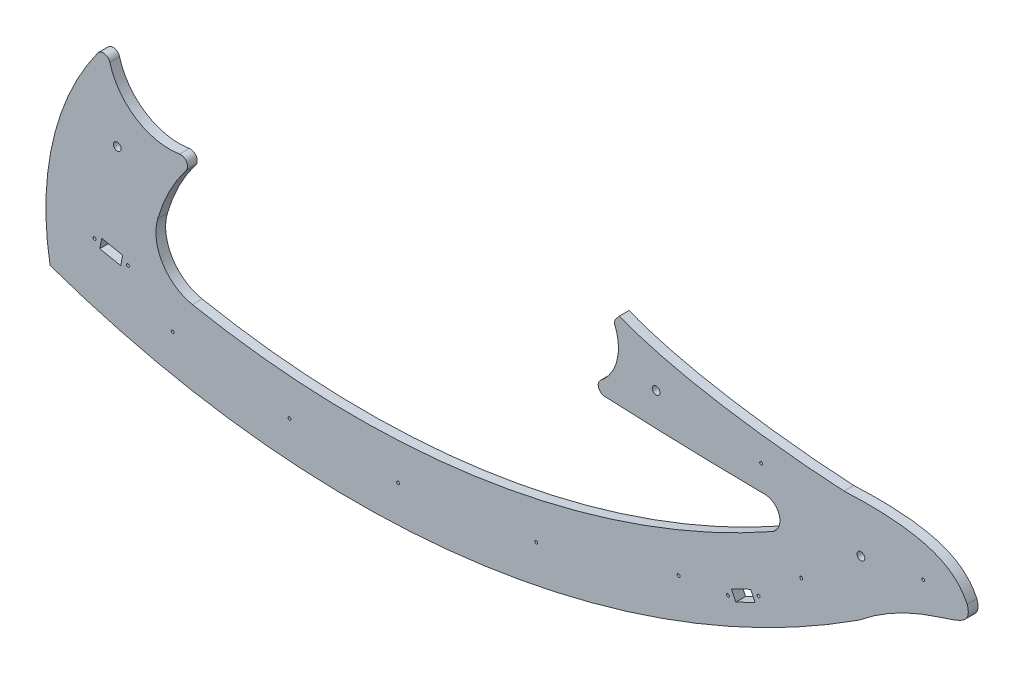
from build123d import *

# Parameters (mm, degrees)
EXTRUDE_3286_DEPTH      = 10
CUT_EXTRUDE_11138_REACH = 1083.261
SKETCH11_R              = 4
SKETCH11_R_2            = 1.5


with BuildPart() as part:
    # Sketch 220 → Extrude 3286 (new body)
    with BuildSketch(Plane.XY):
        with BuildLine():
            Line((398.785011417, -200.651493516), (-79.294784876, -202.700029576))
            add(Edge.make_bspline(
                [(-79.294784876, -202.700029576), (-78.517207033, -227.700030074), (-66.77413567, -249.709423293), (-44.177194857, -268.758733778)],
                knots=[0.130434783, 0.130434783, 0.130434783, 0.130434783, 0.173913043, 0.173913043, 0.173913043, 0.173913043], degree=3))
            add(Edge.make_bspline(
                [(-44.177194857, -268.758733778), (-12.705791537, -245.829015584), (38.959692419, -231.734357298), (82.666649693, -241.803965427)],
                knots=[0.173913043, 0.173913043, 0.173913043, 0.173913043, 0.217391304, 0.217391304, 0.217391304, 0.217391304], degree=3))
            add(Edge.make_bspline(
                [(82.666649693, -241.803965427), (105.678664452, -251.652519997), (111.246401119, -268.691898993), (94.211511027, -290.72343747)],
                knots=[0.217391304, 0.217391304, 0.217391304, 0.217391304, 0.260869565, 0.260869565, 0.260869565, 0.260869565], degree=3))
            add(Edge.make_bspline(
                [(94.211511027, -290.72343747), (87.158146802, -299.84568745), (74.983143168, -308.421687748), (61.059861243, -320.502125148)],
                knots=[0.260869565, 0.260869565, 0.260869565, 0.260869565, 0.304347826, 0.304347826, 0.304347826, 0.304347826], degree=3))
            add(Edge.make_bspline(
                [(61.059861243, -320.502125148), (47.380576162, -331.841195194), (34.883169502, -345.267804883), (22.870464668, -359.106695422)],
                knots=[0.304347826, 0.304347826, 0.304347826, 0.304347826, 0.347826087, 0.347826087, 0.347826087, 0.347826087], degree=3))
            add(Edge.make_bspline(
                [(22.870464668, -359.106695422), (-5.584395486, -391.889656597), (-25.592236503, -386.636342684), (-46.417157713, -376.787588607)],
                knots=[0.347826087, 0.347826087, 0.347826087, 0.347826087, 0.391304348, 0.391304348, 0.391304348, 0.391304348], degree=3))
            add(Edge.make_bspline(
                [(-46.417157713, -376.787588607), (-71.990241561, -366.221906762), (-92.784039707, -356.68149048), (-112.974728727, -345.609360564)],
                knots=[0.391304348, 0.391304348, 0.391304348, 0.391304348, 0.434782609, 0.434782609, 0.434782609, 0.434782609], degree=3))
            ThreePointArc((-112.974728727, -345.609360564), (-147.291018167, -331.50605668), (-183.878601839, -325.353039337))
            ThreePointArc((-183.878601839, -325.353039337), (-234.41691777, -376.347060605), (-177.788935429, -420.480757462))
            ThreePointArc((-177.788935429, -420.480757462), (-128.557787466, -442.172804122), (-130.703269603, -495.928247794))
            ThreePointArc((-130.703269603, -495.928247794), (-178.505297895, -598.929354982), (-181.694355183, -712.437468808))
            ThreePointArc((-181.694355183, -712.437468808), (245.849512772, -759.184021524), (650.190442214, -612.598169561))
            add(Edge.make_bspline(
                [(650.190442214, -612.598169561), (721.726306985, -555.13661338), (771.374178439, -572.802842814), (761.971022851, -542.438303349)],
                knots=[0.695652174, 0.695652174, 0.695652174, 0.695652174, 0.739130435, 0.739130435, 0.739130435, 0.739130435], degree=3))
            add(Edge.make_bspline(
                [(761.971022851, -542.438303349), (749.988144288, -518.251093648), (723.103402832, -500.836242812), (635.239899657, -505.006434182)],
                knots=[0.739130435, 0.739130435, 0.739130435, 0.739130435, 0.782608696, 0.782608696, 0.782608696, 0.782608696], degree=3))
            add(Edge.make_bspline(
                [(635.239899657, -505.006434182), (572.991975282, -501.932832065), (433.550272387, -486.778792548), (380.910397107, -452.903731023)],
                knots=[0.782608696, 0.782608696, 0.782608696, 0.782608696, 0.826086957, 0.826086957, 0.826086957, 0.826086957], degree=3))
            add(Edge.make_bspline(
                [(380.910397107, -452.903731023), (364.765905966, -442.514313456), (356.786231562, -430.363849161), (361.702578451, -416.260911342)],
                knots=[0.826086957, 0.826086957, 0.826086957, 0.826086957, 0.869565217, 0.869565217, 0.869565217, 0.869565217], degree=3))
            add(Edge.make_bspline(
                [(361.702578451, -416.260911342), (369.757666434, -319.561849491), (455.747401527, -287.137003064), (480.242749516, -200.302456329)],
                knots=[0.869565217, 0.869565217, 0.869565217, 0.869565217, 0.913043478, 0.913043478, 0.913043478, 0.913043478], degree=3))
            add(Edge.make_bspline(
                [(480.242749516, -200.302456329), (553.544349425, -5.601453319), (495.010045056, 115.276837959), (568.085803242, 187.174308847)],
                knots=[0.913043478, 0.913043478, 0.913043478, 0.913043478, 0.956521739, 0.956521739, 0.956521739, 0.956521739], degree=3))
            ThreePointArc((568.085803242, 187.174308847), (593.606841589, 203.592061702), (604.925253944, 231.748047725))
            ThreePointArc((604.925253944, 231.748047725), (600.64196866, 247.878688747), (587.30163028, 257.907621119))
            ThreePointArc((587.30163028, 257.907621119), (571.737485415, 260.097118561), (556.344046154, 256.922448156))
            add(Edge.make_bspline(
                [(556.344046154, 256.922448156), (413.493143177, 200.699964154), (492.80385804, -30.446360595), (410.726691822, -175.599321984)],
                knots=[0.000400641, 0.000400641, 0.000400641, 0.000400641, 0.043478261, 0.043478261, 0.043478261, 0.043478261], degree=3))
            add(Edge.make_bspline(
                [(410.726691822, -175.599321984), (407.231033021, -184.649150987), (403.219250068, -192.928185379), (398.785011417, -200.651493516)],
                knots=[0.043478261, 0.043478261, 0.043478261, 0.043478261, 0.086956522, 0.086956522, 0.086956522, 0.086956522], degree=3))
        make_face()
        with BuildLine():
            ThreePointArc((23.550736383, -511.142298049), (288.089199306, -537.834330314), (553.751503672, -548.632616793))
            ThreePointArc((553.751503672, -548.632616793), (568.814439244, -560.451490312), (561.291741423, -578.057932791))
            ThreePointArc((561.291741423, -578.057932791), (271.57991755, -679.226513713), (-35.244735251, -674.063656808))
            ThreePointArc((-35.244735251, -674.063656808), (-65.969287074, -652.699808002), (-70.986403303, -615.615570579))
            ThreePointArc((-70.986403303, -615.615570579), (-41.568101768, -557.565567627), (7.211162456, -514.486307076))
            ThreePointArc((7.211162456, -514.486307076), (15.100477301, -511.443853236), (23.550736383, -511.142298049))
        make_face(mode=Mode.SUBTRACT)
        with BuildLine():
            add(Edge.make_bspline(
                [(97.461776435, -368.948566513), (153.602791073, -313.781374209), (221.486247558, -279.228936332), (313.889089246, -268.758733778)],
                knots=[0.75, 0.75, 0.75, 0.75, 1, 1, 1, 1], degree=3))
            add(Edge.make_bspline(
                [(313.889089246, -268.758733778), (293.563961137, -303.651003731), (262.741092027, -332.899138231), (247.882738821, -396.645799506)],
                knots=[0, 0, 0, 0, 0.25, 0.25, 0.25, 0.25], degree=3))
            add(Edge.make_bspline(
                [(247.882738821, -396.645799506), (222.475445143, -441.097914765), (152.691350033, -451.719558275), (92.090753497, -427.546413805)],
                knots=[0.25, 0.25, 0.25, 0.25, 0.5, 0.5, 0.5, 0.5], degree=3))
            add(Edge.make_bspline(
                [(92.090753497, -427.546413805), (69.794668972, -412.531131284), (70.490548771, -396.456667038), (97.461776435, -368.948566513)],
                knots=[0.5, 0.5, 0.5, 0.5, 0.75, 0.75, 0.75, 0.75], degree=3))
        make_face(mode=Mode.SUBTRACT)
    extrude(amount=EXTRUDE_3286_DEPTH)

    # Sketch11 → Cut-Extrude 11138 (cut, up to next)
    with BuildSketch(Plane.XY.offset(10), mode=Mode.PRIVATE) as cut_extrude_11138_sk1:
        with Locations((-112.549196195, -571.92123641)):
            Circle(SKETCH11_R)
    cut_extrude_11138_tool1 = extrude(cut_extrude_11138_sk1.sketch, amount=-CUT_EXTRUDE_11138_REACH, mode=Mode.PRIVATE) & part.part
    # Sketch11 → Cut-Extrude 11138 (cut, up to next)
    with BuildSketch(Plane.XY.offset(10), mode=Mode.PRIVATE) as cut_extrude_11138_sk2:
        with Locations((652.658313408, -554.355326316)):
            Circle(SKETCH11_R)
    cut_extrude_11138_tool2 = extrude(cut_extrude_11138_sk2.sketch, amount=-CUT_EXTRUDE_11138_REACH, mode=Mode.PRIVATE) & part.part
    # Sketch11 → Cut-Extrude 11138 (cut, up to next)
    with BuildSketch(Plane.XY.offset(10), mode=Mode.PRIVATE) as cut_extrude_11138_sk3:
        with Locations((-55.629283309, -708.500862393)):
            Circle(SKETCH11_R_2)
    cut_extrude_11138_tool3 = extrude(cut_extrude_11138_sk3.sketch, amount=-CUT_EXTRUDE_11138_REACH, mode=Mode.PRIVATE) & part.part
    # Sketch11 → Cut-Extrude 11138 (cut, up to next)
    with BuildSketch(Plane.XY.offset(10), mode=Mode.PRIVATE) as cut_extrude_11138_sk4:
        with Locations((64.612140699, -725.602608911)):
            Circle(SKETCH11_R_2)
    cut_extrude_11138_tool4 = extrude(cut_extrude_11138_sk4.sketch, amount=-CUT_EXTRUDE_11138_REACH, mode=Mode.PRIVATE) & part.part
    # Sketch11 → Cut-Extrude 11138 (cut, up to next)
    with BuildSketch(Plane.XY.offset(10), mode=Mode.PRIVATE) as cut_extrude_11138_sk5:
        with Locations((176.368279192, -727.095308066)):
            Circle(SKETCH11_R_2)
    cut_extrude_11138_tool5 = extrude(cut_extrude_11138_sk5.sketch, amount=-CUT_EXTRUDE_11138_REACH, mode=Mode.PRIVATE) & part.part
    # Sketch11 → Cut-Extrude 11138 (cut, up to next)
    with BuildSketch(Plane.XY.offset(10), mode=Mode.PRIVATE) as cut_extrude_11138_sk6:
        with Locations((318.582103721, -708.992706424)):
            Circle(SKETCH11_R_2)
    cut_extrude_11138_tool6 = extrude(cut_extrude_11138_sk6.sketch, amount=-CUT_EXTRUDE_11138_REACH, mode=Mode.PRIVATE) & part.part
    # Sketch11 → Cut-Extrude 11138 (cut, up to next)
    with BuildSketch(Plane.XY.offset(10), mode=Mode.PRIVATE) as cut_extrude_11138_sk7:
        with Locations((465.030751942, -665.430212723)):
            Circle(SKETCH11_R_2)
    cut_extrude_11138_tool7 = extrude(cut_extrude_11138_sk7.sketch, amount=-CUT_EXTRUDE_11138_REACH, mode=Mode.PRIVATE) & part.part
    # Sketch11 → Cut-Extrude 11138 (cut, up to next)
    with BuildSketch(Plane.XY.offset(10), mode=Mode.PRIVATE) as cut_extrude_11138_sk8:
        with Locations((591.24424266, -604.481261172)):
            Circle(SKETCH11_R_2)
    cut_extrude_11138_tool8 = extrude(cut_extrude_11138_sk8.sketch, amount=-CUT_EXTRUDE_11138_REACH, mode=Mode.PRIVATE) & part.part
    # Sketch11 → Cut-Extrude 11138 (cut, up to next)
    with BuildSketch(Plane.XY.offset(10), mode=Mode.PRIVATE) as cut_extrude_11138_sk9:
        with Locations((549.94258642, -522.830105286)):
            Circle(SKETCH11_R_2)
    cut_extrude_11138_tool9 = extrude(cut_extrude_11138_sk9.sketch, amount=-CUT_EXTRUDE_11138_REACH, mode=Mode.PRIVATE) & part.part
    # Sketch11 → Cut-Extrude 11138 (cut, up to next)
    with BuildSketch(Plane.XY.offset(10), mode=Mode.PRIVATE) as cut_extrude_11138_sk10:
        with Locations((716.702142537, -543.293994414)):
            Circle(SKETCH11_R_2)
    cut_extrude_11138_tool10 = extrude(cut_extrude_11138_sk10.sketch, amount=-CUT_EXTRUDE_11138_REACH, mode=Mode.PRIVATE) & part.part
    # Sketch11 → Cut-Extrude 11138 (cut, up to next)
    with BuildSketch(Plane.XY.offset(10), mode=Mode.PRIVATE) as cut_extrude_11138_sk11:
        with Locations((441.915522151, -512.038121405)):
            Circle(SKETCH11_R)
    cut_extrude_11138_tool11 = extrude(cut_extrude_11138_sk11.sketch, amount=-CUT_EXTRUDE_11138_REACH, mode=Mode.PRIVATE) & part.part
    # Sketch11 → Cut-Extrude 11138 (cut, up to next)
    with BuildSketch(Plane.XY.offset(10), mode=Mode.PRIVATE) as cut_extrude_11138_sk12:
        with Locations((547.310839236, -642.504231246)):
            Circle(SKETCH11_R_2)
    cut_extrude_11138_tool12 = extrude(cut_extrude_11138_sk12.sketch, amount=-CUT_EXTRUDE_11138_REACH, mode=Mode.PRIVATE) & part.part
    # Sketch11 → Cut-Extrude 11138 (cut, up to next)
    with BuildSketch(Plane.XY.offset(10), mode=Mode.PRIVATE) as cut_extrude_11138_sk13:
        with Locations((-101.600852838, -672.407905686)):
            Circle(SKETCH11_R_2)
    cut_extrude_11138_tool13 = extrude(cut_extrude_11138_sk13.sketch, amount=-CUT_EXTRUDE_11138_REACH, mode=Mode.PRIVATE) & part.part
    # Sketch11 → Cut-Extrude 11138 (cut, up to next)
    with BuildSketch(Plane.XY.offset(10), mode=Mode.PRIVATE) as cut_extrude_11138_sk14:
        with Locations((-135.922653361, -665.55122946)):
            Circle(SKETCH11_R_2)
    cut_extrude_11138_tool14 = extrude(cut_extrude_11138_sk14.sketch, amount=-CUT_EXTRUDE_11138_REACH, mode=Mode.PRIVATE) & part.part
    # Sketch11 → Cut-Extrude 11138 (cut, up to next)
    with BuildSketch(Plane.XY.offset(10), mode=Mode.PRIVATE) as cut_extrude_11138_sk15:
        with Locations((515.792122993, -657.721672766)):
            Circle(SKETCH11_R_2)
    cut_extrude_11138_tool15 = extrude(cut_extrude_11138_sk15.sketch, amount=-CUT_EXTRUDE_11138_REACH, mode=Mode.PRIVATE) & part.part
    # Sketch11 → Cut-Extrude 11138 (cut, up to next)
    with BuildSketch(Plane.XY.offset(10), mode=Mode.PRIVATE) as cut_extrude_11138_sk16:
        with BuildLine():
            Line((-41.705819007, -557.743910724), (389.0009277, -543.81527084))
            ThreePointArc((389.0009277, -543.81527084), (382.676824055, -538.982591494), (384.961249536, -531.35825698))
            ThreePointArc((384.961249536, -531.35825698), (401.519975723, -505.885575095), (399.626203266, -475.562934029))
            ThreePointArc((399.626203266, -475.562934029), (399.380095367, -471.072645958), (401.916608675, -467.359243705))
            ThreePointArc((401.916608675, -467.359243705), (421.201667911, -449.430759187), (445.129837883, -438.440456708))
            Line((445.129837883, -438.440456708), (806.492768263, -337.898743925))
            Line((806.492768263, -337.898743925), (641.901405555, 366.465206509))
            Line((641.901405555, 366.465206509), (-477.319818058, -249.120713749))
            Line((-477.319818058, -249.120713749), (-132.599910119, -498.518549796))
            ThreePointArc((-132.599910119, -498.518549796), (-125.690057824, -495.732100316), (-120.183240588, -500.750598434))
            ThreePointArc((-120.183240588, -500.750598434), (-93.070343529, -537.418730172), (-48.39331735, -546.563368155))
            ThreePointArc((-48.39331735, -546.563368155), (-41.241618936, -549.87596337), (-41.705819007, -557.743910724))
        make_face()
    cut_extrude_11138_tool16 = extrude(cut_extrude_11138_sk16.sketch, amount=-CUT_EXTRUDE_11138_REACH, mode=Mode.PRIVATE) & part.part
    # Sketch11 → Cut-Extrude 11138 (cut, up to next)
    with BuildSketch(Plane.XY.offset(10), mode=Mode.PRIVATE) as cut_extrude_11138_sk17:
        Polygon((-128.520103259, -661.676342109), (-130.577106127, -671.972882266), (-109.003402941, -676.282793036), (-106.946400073, -665.98625288), align=None)
    cut_extrude_11138_tool17 = extrude(cut_extrude_11138_sk17.sketch, amount=-CUT_EXTRUDE_11138_REACH, mode=Mode.PRIVATE) & part.part
    # Sketch11 → Cut-Extrude 11138 (cut, up to next)
    with BuildSketch(Plane.XY.offset(10), mode=Mode.PRIVATE) as cut_extrude_11138_sk18:
        Polygon((519.362982639, -650.167769047), (523.928215095, -659.62338392), (543.73997959, -650.058134965), (539.174747134, -640.602520092), align=None)
    cut_extrude_11138_tool18 = extrude(cut_extrude_11138_sk18.sketch, amount=-CUT_EXTRUDE_11138_REACH, mode=Mode.PRIVATE) & part.part
    add(cut_extrude_11138_tool1.solids().sort_by_distance((-112.549196, -571.921236, 10))[0], mode=Mode.SUBTRACT)
    add(cut_extrude_11138_tool2.solids().sort_by_distance((652.658313, -554.355326, 10))[0], mode=Mode.SUBTRACT)
    add(cut_extrude_11138_tool3.solids().sort_by_distance((-55.629283, -708.500862, 10))[0], mode=Mode.SUBTRACT)
    add(cut_extrude_11138_tool4.solids().sort_by_distance((64.612141, -725.602609, 10))[0], mode=Mode.SUBTRACT)
    add(cut_extrude_11138_tool5.solids().sort_by_distance((176.368279, -727.095308, 10))[0], mode=Mode.SUBTRACT)
    add(cut_extrude_11138_tool6.solids().sort_by_distance((318.582104, -708.992706, 10))[0], mode=Mode.SUBTRACT)
    add(cut_extrude_11138_tool7.solids().sort_by_distance((465.030752, -665.430213, 10))[0], mode=Mode.SUBTRACT)
    add(cut_extrude_11138_tool8.solids().sort_by_distance((591.244243, -604.481261, 10))[0], mode=Mode.SUBTRACT)
    add(cut_extrude_11138_tool9.solids().sort_by_distance((549.942586, -522.830105, 10))[0], mode=Mode.SUBTRACT)
    add(cut_extrude_11138_tool10.solids().sort_by_distance((716.702143, -543.293994, 10))[0], mode=Mode.SUBTRACT)
    add(cut_extrude_11138_tool11.solids().sort_by_distance((441.915522, -512.038121, 10))[0], mode=Mode.SUBTRACT)
    add(cut_extrude_11138_tool12.solids().sort_by_distance((547.310839, -642.504231, 10))[0], mode=Mode.SUBTRACT)
    add(cut_extrude_11138_tool13.solids().sort_by_distance((-101.600853, -672.407906, 10))[0], mode=Mode.SUBTRACT)
    add(cut_extrude_11138_tool14.solids().sort_by_distance((-135.922653, -665.551229, 10))[0], mode=Mode.SUBTRACT)
    add(cut_extrude_11138_tool15.solids().sort_by_distance((515.792123, -657.721673, 10))[0], mode=Mode.SUBTRACT)
    add(cut_extrude_11138_tool16.solids().sort_by_distance((257.831895, -175.11907, 10))[0], mode=Mode.SUBTRACT)
    add(cut_extrude_11138_tool17.solids().sort_by_distance((-118.761753, -668.979568, 10))[0], mode=Mode.SUBTRACT)
    add(cut_extrude_11138_tool18.solids().sort_by_distance((531.551481, -650.112952, 10))[0], mode=Mode.SUBTRACT)


solid = part.part
